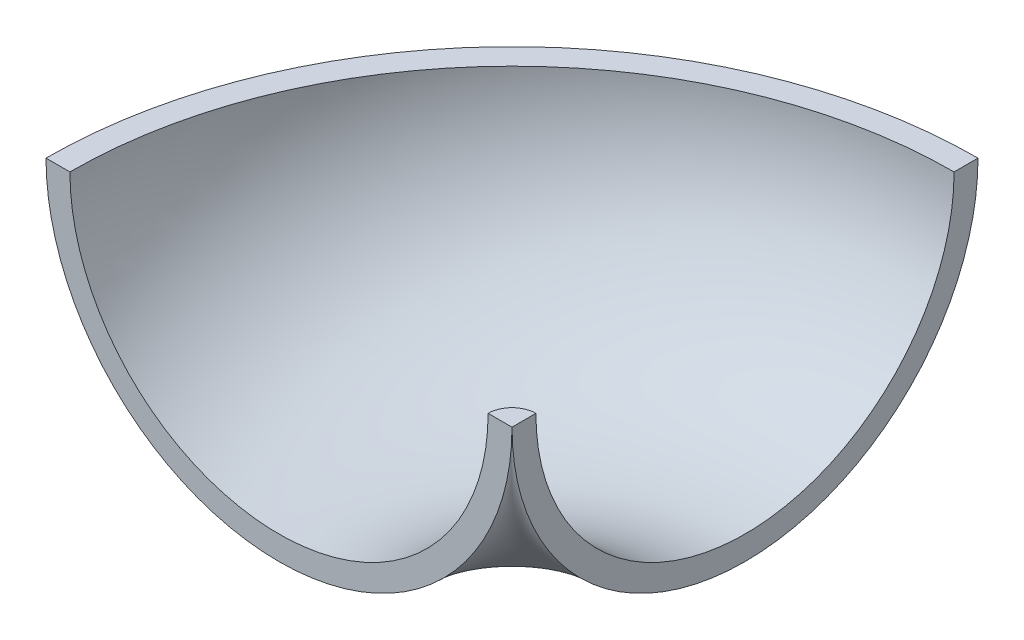
from build123d import *


with BuildPart() as part:
    # Sweep2: sweep along a path in Sketch16
    with BuildLine(Plane(origin=(0, 0, 0), x_dir=(1, 0, 0), z_dir=(0, 1, 0))) as sweep2_path:
        ThreePointArc((-39, 0), (-27.577164466, 27.577164466), (0, 39))
    # Sketch17 → Sweep2 (sweep)
    with BuildSketch(Plane.XY):
        with BuildLine():
            Line((-78, 0), (-74, 0))
            ThreePointArc((-74, 0), (-39, -35), (-4, 0))
            Line((-4, 0), (0, 0))
            ThreePointArc((0, 0), (-39, -39), (-78, 0))
        make_face()
    sweep(path=sweep2_path.line)


solid = part.part
